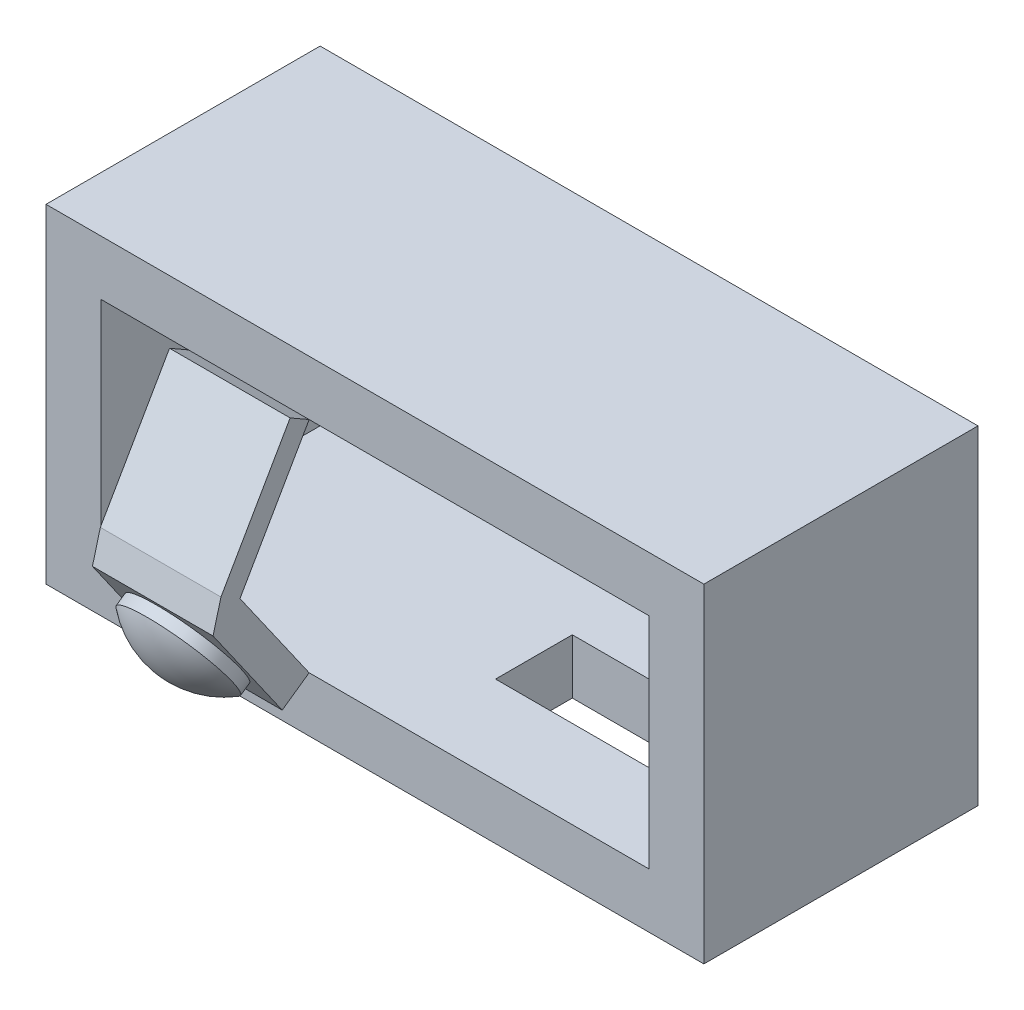
from build123d import *

# Parameters (mm, degrees)
SKETCH1_W           = 60
SKETCH1_H           = 30
BOSS_EXTRUDE1_DEPTH = 5
SKETCH3_W           = 60
SKETCH3_H           = 30
SKETCH3_W_2         = 50
SKETCH3_H_2         = 20
BOSS_EXTRUDE2_DEPTH = 20
SKETCH4_W           = 2
SKETCH4_H           = 15
CUT_EXTRUDE1_DEPTH  = 20
SKETCH5_W           = 17
SKETCH5_H           = 7
CUT_EXTRUDE2_DEPTH  = 20
SKETCH6_W           = 11
SKETCH6_H           = 11
SKETCH6_W_2         = 7
SKETCH6_H_2         = 7
BOSS_EXTRUDE3_DEPTH = 3
BOSS_EXTRUDE5_START = 3
SKETCH10_R          = 4.949747468
BOSS_EXTRUDE5_DEPTH = 1
DOME5_FACE_RADIUS   = 4.949747468
DOME5_HEIGHT        = 2
SKETCH12_W          = 11
SKETCH12_H          = 12.671744178
BOSS_EXTRUDE9_DEPTH = 2
LOFT1_START         = -17
LOFT1_DEPTH         = 11


# Read off the part's stored shape, not the designer's step: Shell1, Loft1
with BuildPart() as part:
    # Sketch1 → Boss-Extrude1 (new body)
    with BuildSketch(Plane.XY):
        Rectangle(SKETCH1_W, SKETCH1_H)
    extrude(amount=BOSS_EXTRUDE1_DEPTH)

    # Sketch3 → Boss-Extrude2 (add)
    with BuildSketch(Plane.XY.offset(5)):
        Rectangle(SKETCH3_W, SKETCH3_H)
        Rectangle(SKETCH3_W_2, SKETCH3_H_2, mode=Mode.SUBTRACT)
    extrude(amount=BOSS_EXTRUDE2_DEPTH)

    # Sketch4 → Cut-Extrude1 (cut)
    with BuildSketch(Plane(origin=(0, 0, 0), x_dir=(-1, 0, 0), z_dir=(0, 0, -1))):
        with Locations((-17, 0)):
            Rectangle(SKETCH4_W, SKETCH4_H)
        with Locations((-10, 0)):
            Rectangle(SKETCH4_W, SKETCH4_H)
        with Locations((-3, 0)):
            Rectangle(SKETCH4_W, SKETCH4_H)
    cut_extrude1 = extrude(amount=-CUT_EXTRUDE1_DEPTH, mode=Mode.SUBTRACT)

    # Mirror1: Cut-Extrude1 across plane
    add(cut_extrude1.mirror(Plane(origin=(0, 0, 0), x_dir=(0, 0, 1), z_dir=(1, 0, 0))), mode=Mode.SUBTRACT)

    # Sketch5 → Cut-Extrude2 (cut)
    with BuildSketch(Plane(origin=(0, -10, 0), x_dir=(1, 0, 0), z_dir=(0, 1, 0))):
        with Locations((11.5, -13.5)):
            Rectangle(SKETCH5_W, SKETCH5_H)
    extrude(amount=-CUT_EXTRUDE2_DEPTH, mode=Mode.SUBTRACT)


with BuildPart() as body_2:
    # Sketch6 → Boss-Extrude3 (new body)
    with BuildSketch(Plane(origin=(0, -15.036057043, 21.473714896), x_dir=(1, 0, 0), z_dir=(0, -0.5735764363510473, 0.819152044288991))):
        with Locations((-11.5, 11.647890466)):
            Rectangle(SKETCH6_W, SKETCH6_H)
        with Locations((-11.5, 11.647890466)):
            Rectangle(SKETCH6_W_2, SKETCH6_H_2, mode=Mode.SUBTRACT)
    extrude(amount=BOSS_EXTRUDE3_DEPTH)



with BuildPart() as body_3:
    # Sketch10 → Boss-Extrude5 (new body)
    with BuildSketch(Plane(origin=(0, -15.036057043, 21.473714896), x_dir=(1, 0, 0), z_dir=(0, -0.5735764363510473, 0.819152044288991)).offset(BOSS_EXTRUDE5_START)):
        with Locations(Location((-11.5, 11.647890466, 0), (0, 0, 270))):
            Circle(SKETCH10_R)
    extrude(amount=BOSS_EXTRUDE5_DEPTH)

    # Dome5: a dome of height H over a round flat face of radius A is a cap of a sphere of radius (A * A + H * H) / (2 * H)
    dome5_r = (DOME5_FACE_RADIUS * DOME5_FACE_RADIUS + DOME5_HEIGHT * DOME5_HEIGHT) / (2 * DOME5_HEIGHT)
    dome5_base = Plane((-11.5, -7.788969502, 31.431278577), z_dir=(0, -0.573576436351, 0.819152044289))
    with Locations(dome5_base.offset(DOME5_HEIGHT - dome5_r)):
        dome5_ball = Sphere(dome5_r, mode=Mode.PRIVATE)
    add(split(dome5_ball, bisect_by=dome5_base, keep=Keep.TOP, mode=Mode.PRIVATE))

    # Shell1 outline → Shell1 (revolve, cut)
    with BuildSketch(Plane(origin=(-11.5, 9.541393287, 6.680955504), x_dir=(1, 0, 0), z_dir=(0, 0.8191520442889911, 0.5735764363510472))):
        with BuildLine():
            ThreePointArc((0, -31.214565471), (2.10265339, -30.842345123), (3.949747473, -29.770924237))
            Line((3.949747473, -29.770924237), (3.949747468, -29.214565471))
            Line((3.949747468, -29.214565471), (0, -29.214565471))
            Line((0, -29.214565471), (0, -31.214565471))
        make_face()
    revolve(axis=Axis((-11.5, 9.541393287, 6.680955504), (0, 0.5735764363510472, -0.8191520442889911)), mode=Mode.SUBTRACT)


with BuildPart() as body_4:
    # Sketch12 → Boss-Extrude9 (new body)
    with BuildSketch(Plane(origin=(0, 13.274098323, 23.12023055), x_dir=(-1, 0, 0), z_dir=(0, -0.4979062638284767, -0.8672308530260945))):
        with Locations((11.5, -10.111220154)):
            Rectangle(SKETCH12_W, SKETCH12_H)
    extrude(amount=-BOSS_EXTRUDE9_DEPTH)


with BuildPart() as body_2_1:
    add(body_2.part)

    add(body_4.part)  # Loft1 merges body 4
    # Loft1 outline → Loft1 (add)
    with BuildSketch(Plane.YZ.offset(LOFT1_START)):
        Polygon((-0.989327513, 31.3093408), (0.006485015, 33.043802506), (-2.710056822, 33.766796933), align=None)
    extrude(amount=LOFT1_DEPTH)


solid = Compound([part.part, body_3.part, body_2_1.part])
